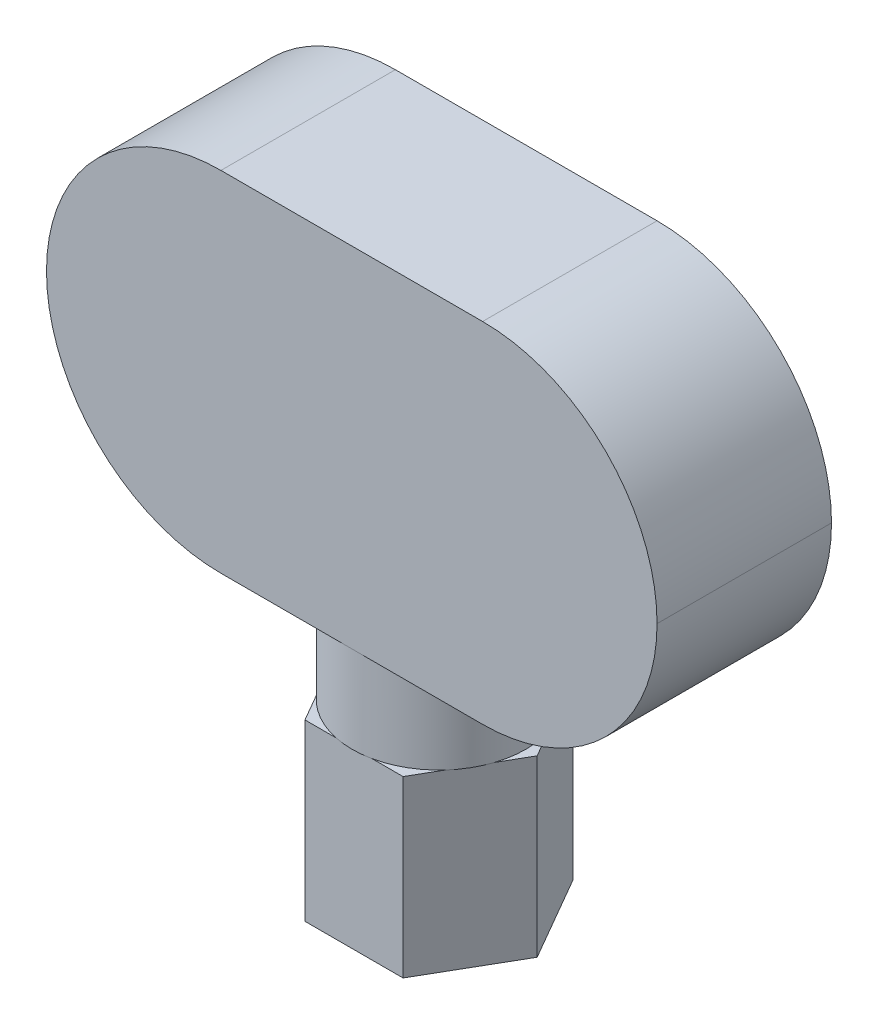
from build123d import *

# Parameters (mm, degrees)
BOSS_EXTRUDE1_DEPTH = 4
SKETCH3_R           = 1.991858429
BOSS_EXTRUDE3_DEPTH = 2
SKETCH2_W           = 14
SKETCH2_H           = 4
BOSS_EXTRUDE2_DEPTH = 8
FILLET1_R           = 4


with BuildPart() as part:
    # Sketch1 → Boss-Extrude1 (new body)
    with BuildSketch(Plane(origin=(0, 0, 0), x_dir=(1, 0, 0), z_dir=(0, 1, 0))):
        Polygon((1.125, 1.948557159), (-1.125, 1.948557159), (-2.25, 0), (-1.125, -1.948557159), (1.125, -1.948557159), (2.25, 0), align=None)
    extrude(amount=BOSS_EXTRUDE1_DEPTH)

    # Sketch3 → Boss-Extrude3 (add)
    with BuildSketch(Plane(origin=(0, 4, 0), x_dir=(1, 0, 0), z_dir=(0, 1, 0))):
        with Locations(Location((0, 0, 0), (0, 0, 78.031254445))):
            Circle(SKETCH3_R)
    extrude(amount=BOSS_EXTRUDE3_DEPTH)

    # Sketch2 → Boss-Extrude2 (add)
    with BuildSketch(Plane(origin=(0, 6, 0), x_dir=(1, 0, 0), z_dir=(0, 1, 0))):
        Rectangle(SKETCH2_W, SKETCH2_H)
    extrude(amount=BOSS_EXTRUDE2_DEPTH)

    # Fillet1
    fillet1_edges = [part.edges().sort_by_distance(p)[0] for p in [
        (7, 6, 0),
        (7, 14, 0),
        (-7, 6, 0),
        (-7, 14, 0),
    ]]
    fillet(fillet1_edges, radius=FILLET1_R - 0.0001)  # a hair under: the kernel refuses the full size


solid = part.part
